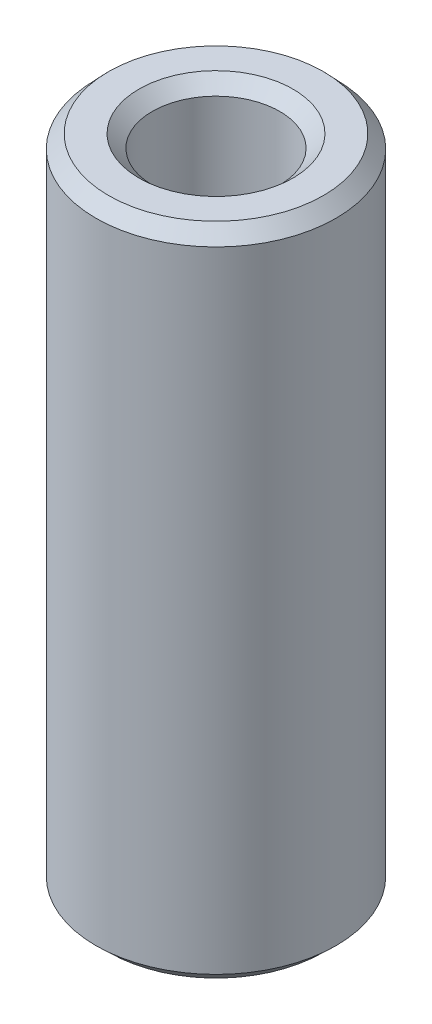
from build123d import *
from OCP.BRepFilletAPI import BRepFilletAPI_MakeChamfer

# Parameters (mm, degrees)
SKETCH1_R           = 35
BOSS_EXTRUDE1_DEPTH = 191.280801122
SKETCH2_R           = 18.581410231
CUT_EXTRUDE1_DEPTH  = 198.581236148
CHAMFER1_SIZE       = 3.893633686
CHAMFER1_SIZE2      = 3.682053034


with BuildPart() as part:
    # Sketch1 → Boss-Extrude1 (new body)
    with BuildSketch(Plane(origin=(0, 0, 0), x_dir=(1, 0, 0), z_dir=(0, 1, 0))):
        Circle(SKETCH1_R)
    extrude(amount=BOSS_EXTRUDE1_DEPTH)

    # Sketch2 → Cut-Extrude1 (cut, through all)
    with BuildSketch(Plane(origin=(0, 0, 0), x_dir=(1, 0, 0), z_dir=(0, 1, 0))):
        Circle(SKETCH2_R)
    extrude(amount=CUT_EXTRUDE1_DEPTH, mode=Mode.SUBTRACT)

    # Chamfer1: one chamfer whose edges measure the first distance from different faces: ONE call of the kernel's chamfer builder (chamfer() names one face for all edges)
    chamfer1_edges_1 = [part.edges().sort_by_distance(p)[0] for p in [
        (-18.581410231, 191.280801122, 0),
    ]]
    chamfer1_side_1 = [part.faces().sort_by_distance(p)[0] for p in [
        (-34.010050506, 191.280801122, 0),
    ]]
    chamfer1_edges_2 = [part.edges().sort_by_distance(p)[0] for p in [
        (-18.581410231, 0, 0),
    ]]
    chamfer1_side_2 = [part.faces().sort_by_distance(p)[0] for p in [
        (-18.581410231, 95.640400561, 0),
    ]]
    chamfer1_edges_3 = [part.edges().sort_by_distance(p)[0] for p in [
        (-35, 0, 0),
    ]]
    chamfer1_side_3 = [part.faces().sort_by_distance(p)[0] for p in [
        (-34.010050506, 0, 0),
    ]]
    chamfer1_edges_4 = [part.edges().sort_by_distance(p)[0] for p in [
        (-35, 191.280801122, 0),
    ]]
    chamfer1_side_4 = [part.faces().sort_by_distance(p)[0] for p in [
        (-35, 95.640400561, 0),
    ]]
    chamfer1 = BRepFilletAPI_MakeChamfer(part.part.solid().wrapped)
    for e in chamfer1_edges_1:
        chamfer1.Add(CHAMFER1_SIZE, CHAMFER1_SIZE2, e.wrapped, chamfer1_side_1[0].wrapped)  # the first distance lies on this face
    for e in chamfer1_edges_2:
        chamfer1.Add(CHAMFER1_SIZE, CHAMFER1_SIZE2, e.wrapped, chamfer1_side_2[0].wrapped)  # the first distance lies on this face
    for e in chamfer1_edges_3:
        chamfer1.Add(CHAMFER1_SIZE, CHAMFER1_SIZE2, e.wrapped, chamfer1_side_3[0].wrapped)  # the first distance lies on this face
    for e in chamfer1_edges_4:
        chamfer1.Add(CHAMFER1_SIZE, CHAMFER1_SIZE2, e.wrapped, chamfer1_side_4[0].wrapped)  # the first distance lies on this face
    add(Compound.cast(chamfer1.Shape()), mode=Mode.REPLACE)


solid = part.part
